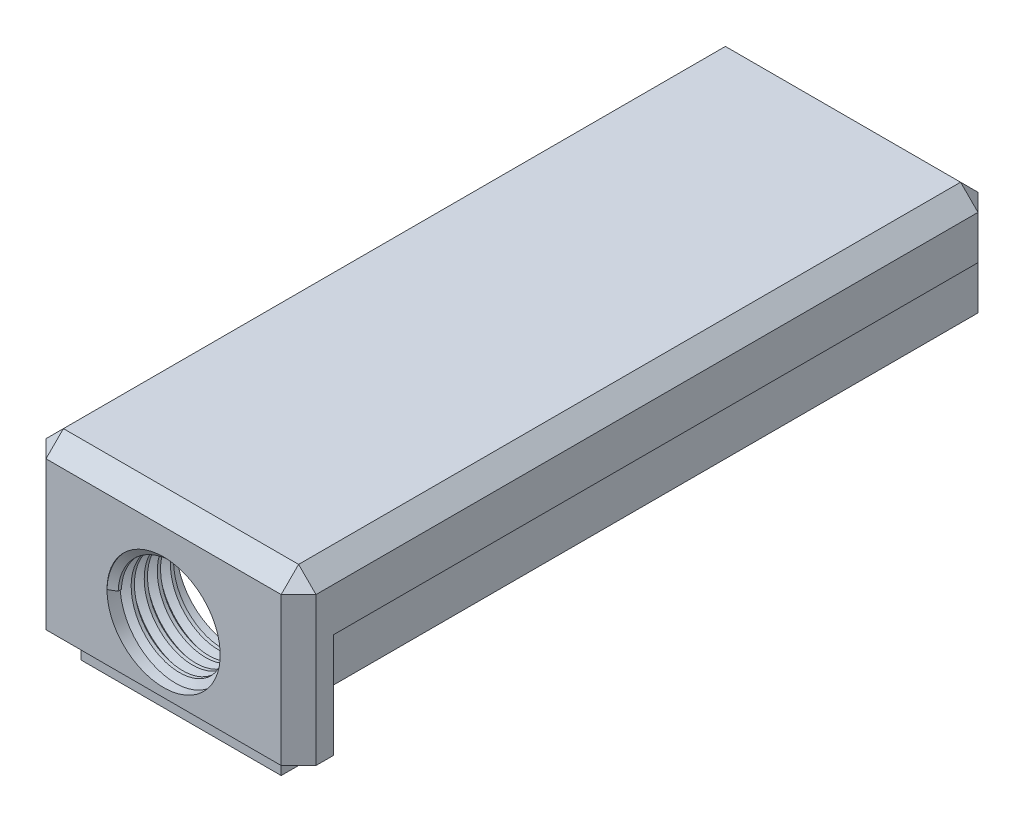
from build123d import *

# Parameters (mm, degrees)
SKETCH2_W                 = 31
SKETCH2_H                 = 80
BOSS_EXTRUDE1_DEPTH       = 7
BOSS_EXTRUDE4_DEPTH       = 3
CUT_EXTRUDE1_DEPTH        = 3
CUT_EXTRUDE2_DEPTH        = 3
SKETCH11_R                = 1.3
BOSS_EXTRUDE6_DEPTH       = 5
SKETCH12_W                = 31
SKETCH12_H                = 4
BOSS_EXTRUDE7_DEPTH       = 12
BOSS_EXTRUDE8_DEPTH       = 6
BOSS_EXTRUDE9_DEPTH       = 6
CHAMFER2_SIZE             = 2
SKETCH15_W                = 23
SKETCH15_H                = 2
BOSS_EXTRUDE10_DEPTH      = 3
SKETCH16_R                = 7.45
BOSS_EXTRUDE15_DEPTH      = 4
M12_CLEARANCE_HOLE1_D     = 13
M12_CLEARANCE_HOLE1_DEPTH = 8
M12_CLEARANCE_HOLE1_TIP   = 3.905594024
THREAD1_PITCH             = 1.5


with BuildPart() as part:
    # Sketch2 → Boss-Extrude1 (new body)
    with BuildSketch(Plane(origin=(0, 0, 0), x_dir=(1, 0, 0), z_dir=(0, 1, 0))):
        with Locations((11.932252056, 319.133342367)):
            Rectangle(SKETCH2_W, SKETCH2_H)
    extrude(amount=BOSS_EXTRUDE1_DEPTH)

    # Sketch3 → Boss-Extrude4 (add)
    with BuildSketch(Plane.XZ):
        with BuildLine():
            Line((0.432252056, -283.133342367), (23.432252056, -283.133342367))
            Line((23.432252056, -283.133342367), (23.432252056, -321.133342367))
            ThreePointArc((23.432252056, -321.133342367), (21.432252056, -323.133342367), (23.432252056, -325.133342367))
            Line((23.432252056, -325.133342367), (23.432252056, -359.133342367))
            Line((23.432252056, -359.133342367), (0.432252056, -359.133342367))
            Line((0.432252056, -359.133342367), (0.432252056, -325.133342367))
            ThreePointArc((0.432252056, -325.133342367), (2.432252056, -323.133342367), (0.432252056, -321.133342367))
            Line((0.432252056, -321.133342367), (0.432252056, -283.133342367))
        make_face()
    extrude(amount=-BOSS_EXTRUDE4_DEPTH)

    # Sketch6 → Cut-Extrude1 (cut)
    with BuildSketch(Plane.XZ):
        with BuildLine():
            Line((0.232252056, -359.133342367), (23.632252056, -359.133342367))
            Line((23.632252056, -359.133342367), (23.632252056, -354.833342367))
            ThreePointArc((23.632252056, -354.833342367), (21.932252056, -353.133342367), (23.632252056, -351.433342367))
            Line((23.632252056, -351.433342367), (23.632252056, -313.133342367))
            Line((23.632252056, -313.133342367), (23.132252056, -313.133342367))
            Line((23.132252056, -313.133342367), (23.132252056, -301.133342367))
            Line((23.132252056, -301.133342367), (23.632252056, -301.133342367))
            Line((23.632252056, -301.133342367), (23.632252056, -283.133342367))
            Line((23.632252056, -283.133342367), (0.232252056, -283.133342367))
            Line((0.232252056, -283.133342367), (0.232252056, -301.133342367))
            Line((0.232252056, -301.133342367), (0.732252056, -301.133342367))
            Line((0.732252056, -301.133342367), (0.732252056, -313.133342367))
            Line((0.732252056, -313.133342367), (0.232252056, -313.133342367))
            Line((0.232252056, -313.133342367), (0.232252056, -351.433342367))
            ThreePointArc((0.232252056, -351.433342367), (1.932252056, -353.133342367), (0.232252056, -354.833342367))
            Line((0.232252056, -354.833342367), (0.232252056, -359.133342367))
        make_face()
    extrude(amount=-CUT_EXTRUDE1_DEPTH, mode=Mode.SUBTRACT)

    # Sketch10 → Cut-Extrude2 (cut)
    with BuildSketch(Plane.XZ.offset(-3)):
        with BuildLine():
            Line((8.232252056, -335.633342367), (15.232252056, -335.633342367))
            ThreePointArc((15.232252056, -335.633342367), (16.732252056, -337.133342367), (15.232252056, -338.633342367))
            Line((15.232252056, -338.633342367), (8.232252056, -338.633342367))
            ThreePointArc((8.232252056, -338.633342367), (6.732252056, -337.133342367), (8.232252056, -335.633342367))
        make_face()
    extrude(amount=-CUT_EXTRUDE2_DEPTH, mode=Mode.SUBTRACT)

    # Sketch11 → Boss-Extrude6 (add)
    with BuildSketch(Plane.XZ.offset(-3)):
        with Locations(Location((8.262252056, -307.133342367, 0), (0, 0, 270))):
            Circle(SKETCH11_R)
        with Locations(Location((15.535240447, -307.133342367, 0), (0, 0, 270))):
            Circle(SKETCH11_R)
    extrude(amount=BOSS_EXTRUDE6_DEPTH)

    # Sketch12 → Boss-Extrude7 (add)
    with BuildSketch(Plane.XZ):
        with Locations((11.932252056, -281.133342367)):
            Rectangle(SKETCH12_W, SKETCH12_H)
    extrude(amount=BOSS_EXTRUDE7_DEPTH)

    # Sketch13 → Boss-Extrude8 (add)
    with BuildSketch(Plane.XZ):
        Polygon((-2.567747944, -283.133342367), (-0.567747944, -283.133342367), (-0.567747944, -356.133342367), (0.232252056, -356.133342367), (0.232252056, -358.133342367), (-0.567747944, -358.133342367), (-2.567747944, -358.133342367), align=None)
    extrude(amount=BOSS_EXTRUDE8_DEPTH)

    # Sketch14 → Boss-Extrude9 (add)
    with BuildSketch(Plane.XZ):
        Polygon((24.432252056, -283.133342367), (26.432252056, -283.133342367), (26.432252056, -358.133342367), (24.432252056, -358.133342367), (23.632252056, -358.133342367), (23.632252056, -356.133342367), (24.432252056, -356.133342367), align=None)
    extrude(amount=BOSS_EXTRUDE9_DEPTH)

    # Chamfer2
    chamfer2_edges = [part.edges().sort_by_distance(p)[0] for p in [
        (27.432252056, 7, -319.133342367),
        (11.932252056, 7, -359.133342367),
        (-3.567747944, 7, -319.133342367),
        (-3.567747944, 3.5, -359.133342367),
        (27.432252056, 3.5, -359.133342367),
        (27.432252056, -2.5, -279.133342367),
        (-3.567747944, -2.5, -279.133342367),
        (11.932252056, 7, -279.133342367),
    ]]
    chamfer(chamfer2_edges, length=CHAMFER2_SIZE - 0.0001)  # a hair under: the kernel refuses the full size

    # Sketch15 → Boss-Extrude10 (add)
    with BuildSketch(Plane.XZ.offset(12)):
        with Locations((11.932252056, -282.133342367)):
            Rectangle(SKETCH15_W, SKETCH15_H)
    extrude(amount=BOSS_EXTRUDE10_DEPTH)

    # Sketch16 → Boss-Extrude15 (add)
    with BuildSketch(Plane(origin=(0, 0, -283.133342367), x_dir=(-1, 0, 0), z_dir=(0, 0, -1))):
        with Locations(Location((-11.932252056, -4.5, 0), (0, 0, 180))):
            Circle(SKETCH16_R)
    extrude(amount=BOSS_EXTRUDE15_DEPTH)

    # M12 Clearance Hole1
    with Locations(Plane.XY.offset(-279.133342367)):
        with Locations((11.932252056, -4.5)):
            Hole(M12_CLEARANCE_HOLE1_D / 2, depth=M12_CLEARANCE_HOLE1_DEPTH)
            with Locations((0, 0, -(M12_CLEARANCE_HOLE1_DEPTH + M12_CLEARANCE_HOLE1_TIP / 2))):  # 118° drill point
                Cone(0, M12_CLEARANCE_HOLE1_D / 2, M12_CLEARANCE_HOLE1_TIP, mode=Mode.SUBTRACT)

    # Thread1: the profile of Thread Profile1 profile screwed along a right-hand helix of 4.416667 turns, 8 arcs to a turn; built about Z, then put on its axis
    thread1_z = Axis((0, 0, 0), (0, 0, 1))
    thread1_corners = [(6.5003, 0, -0.000173205), (6.5003, 0, 1.312673201), (5.688101187, 0, 0.843749998), (5.688101187, 0, 0.468749998)]
    with BuildLine(mode=Mode.PRIVATE) as thread1_profile:
        Line(thread1_corners[0], thread1_corners[1])
        Line(thread1_corners[1], thread1_corners[2])
        Line(thread1_corners[2], thread1_corners[3])
        Line(thread1_corners[3], thread1_corners[0])
    thread1_cap = Face(thread1_profile.wire())
    thread1_turn_angles = [0, 22.5, 45, 67.5, 90, 112.5, 135, 157.5, 180, 202.5, 225, 247.5, 270, 292.5, 315, 337.5, 360]
    thread1_turn_weights = [1, 0.9238795325112867, 1, 0.9238795325112867, 1, 0.9238795325112867, 1, 0.9238795325112867, 1, 0.9238795325112867, 1, 0.9238795325112867, 1, 0.9238795325112867, 1, 0.9238795325112867, 1]
    thread1_turn_rails = [Edge.make_bspline([Vector(p[0], p[1], 0).rotate(thread1_z, thread1_turn_angles[k]) / thread1_turn_weights[k] + Vector(0, 0, p[2] + THREAD1_PITCH * thread1_turn_angles[k] / 360) for k in range(17)], [0, 0, 0, 1, 1, 2, 2, 3, 3, 4, 4, 5, 5, 6, 6, 7, 7, 8, 8, 8], 2, thread1_turn_weights) for p in thread1_corners]
    thread1_turn_sides = [Face.make_surface_from_curves(thread1_turn_rails[p[0]], thread1_turn_rails[p[1]]) for p in [(0, 1), (1, 2), (2, 3), (3, 0)]]
    thread1_last_angles = [1440, 1462.5, 1485, 1507.5, 1530, 1552.5, 1575, 1582.5, 1590]
    thread1_last_weights = [1, 0.9238795325112867, 1, 0.9238795325112867, 1, 0.9238795325112867, 1, 0.9914448613738107, 1]
    thread1_last_rails = [Edge.make_bspline([Vector(p[0], p[1], 0).rotate(thread1_z, thread1_last_angles[k]) / thread1_last_weights[k] + Vector(0, 0, p[2] + THREAD1_PITCH * thread1_last_angles[k] / 360) for k in range(9)], [0, 0, 0, 1, 1, 2, 2, 3, 3, 4, 4, 4], 2, thread1_last_weights) for p in thread1_corners]
    thread1_last_sides = [Face.make_surface_from_curves(thread1_last_rails[p[0]], thread1_last_rails[p[1]]) for p in [(0, 1), (1, 2), (2, 3), (3, 0)]]
    thread1 = Plane(origin=(11.932252056, -4.5, -279.133342367), x_dir=(-1, 0, 0), z_dir=(0, 0, -1)) * Solid(Shell([*[p.moved(Location((0, 0, THREAD1_PITCH * i))) for i in range(4) for p in thread1_turn_sides], *thread1_last_sides, thread1_cap, thread1_cap.rotate(thread1_z, 1590).moved(Location((0, 0, THREAD1_PITCH * 1590 / 360)))]))
    add(thread1)


solid = part.part
